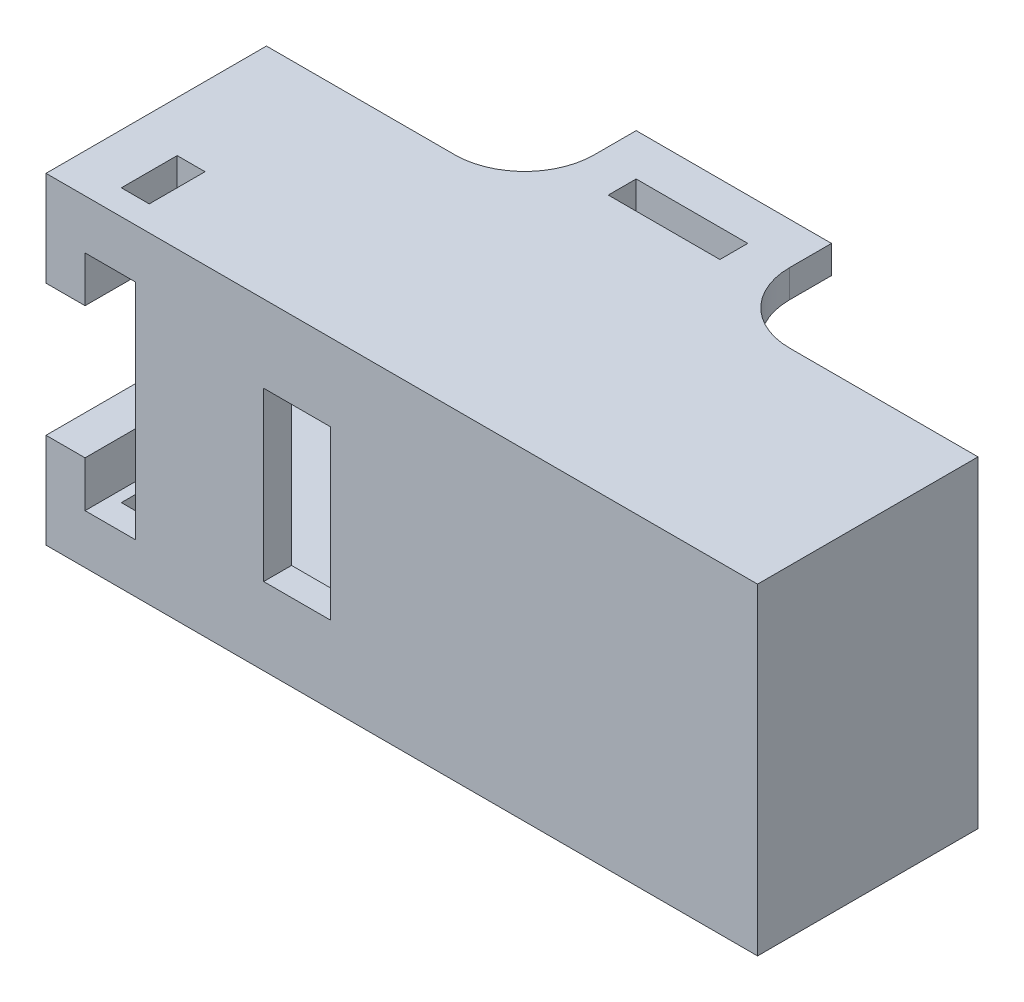
from build123d import *

# Parameters (mm, degrees)
ESQUISSE1_W                  = 12.75
ESQUISSE1_H                  = 5.77
BASE_EXTRUSION_DEPTH         = 5.95
ENL_V_MAT_EXTRU_1_DEPTH      = 1.68
COQUE1_OUTLINE_W             = 10.15
COQUE1_OUTLINE_H             = 4.77
COQUE1_DEPTH                 = 5.45
COQUE1_2_OUTLINE_W           = 1.6
COQUE1_2_OUTLINE_H           = 4.77
COQUE1_2_DEPTH               = 3.77
ENL_V_MAT_EXTRU_2_DEPTH      = 10.185115677
ENL_V_MAT_EXTRU_3_DEPTH      = 10.185115677
ENL_V_MAT_EXTRU_3_DEPTH_BACK = 10.185115677
ESQUISSE4_W                  = 2
ESQUISSE4_H                  = 0.5
ESQUISSE4_W_2                = 0.5
ESQUISSE4_H_2                = 1
ESQUISSE5_W                  = 1.2
ESQUISSE5_H                  = 3
ENL_V_MAT_EXTRU_4_DEPTH      = 10.185115677


# Read off the part's stored shape, not the designer's step: Coque1
with BuildPart() as part:
    # Esquisse1 → Base-Extrusion (new body)
    with BuildSketch(Plane.XY):
        Rectangle(ESQUISSE1_W, ESQUISSE1_H)
    extrude(amount=BASE_EXTRUSION_DEPTH)

    # Esquisse2 → Enlèv. mat.-Extru.1 (cut)
    with BuildSketch(Plane.XY.offset(5.95)):
        Polygon((-5.675, 2), (-4.775, 2), (-4.775, -2), (-5.675, -2), (-5.675, -1.18), (-6.375, -1.18), (-6.375, 1.18), (-5.675, 1.18), align=None)
    extrude(amount=-ENL_V_MAT_EXTRU_1_DEPTH, mode=Mode.SUBTRACT)

    # Coque1 outline → Coque1 (cut)
    with BuildSketch(Plane.XY):
        with Locations((0.8, 0)):
            Rectangle(COQUE1_OUTLINE_W, COQUE1_OUTLINE_H)
    extrude(amount=COQUE1_DEPTH, mode=Mode.SUBTRACT)

    # Coque1 2 outline → Coque1 2 (cut)
    with BuildSketch(Plane.XY):
        with Locations((-5.075, 0)):
            Rectangle(COQUE1_2_OUTLINE_W, COQUE1_2_OUTLINE_H)
    extrude(amount=COQUE1_2_DEPTH, mode=Mode.SUBTRACT)

    # Esquisse3 → Enlèv. mat.-Extru.2 (cut, symmetric)
    with BuildSketch(Plane(origin=(0, 0, 0), x_dir=(1, 0, 0), z_dir=(0, 1, 0))):
        with BuildLine():
            Line((6.375, -2), (3, -2))
            ThreePointArc((3, -2), (2.116116524, -1.633883476), (1.75, -0.75))
            Line((1.75, -0.75), (1.75, 0))
            Line((1.75, 0), (6.375, 0))
            Line((6.375, 0), (6.375, -2))
        make_face()
    enl_v_mat_extru_2 = extrude(amount=ENL_V_MAT_EXTRU_2_DEPTH, both=True, mode=Mode.SUBTRACT)

    # Symétrie1: Enlèv. mat.-Extru.2 across plane
    add(enl_v_mat_extru_2.mirror(Plane(origin=(0, 0, 0), x_dir=(0, 0, 1), z_dir=(1, 0, 0))), mode=Mode.SUBTRACT)

    # Esquisse4 → Enlèv. mat.-Extru.3 (cut, two sides: drawn at the far end of the back side and taken through both)
    with BuildSketch(Plane(origin=(0, 0, 0), x_dir=(1, 0, 0), z_dir=(0, 1, 0)).offset(-ENL_V_MAT_EXTRU_3_DEPTH_BACK)):
        with Locations((0, -1)):
            Rectangle(ESQUISSE4_W, ESQUISSE4_H)
        with Locations((-5.225, -5)):
            Rectangle(ESQUISSE4_W_2, ESQUISSE4_H_2)
    extrude(amount=ENL_V_MAT_EXTRU_3_DEPTH + ENL_V_MAT_EXTRU_3_DEPTH_BACK, mode=Mode.SUBTRACT)

    # Esquisse5 → Enlèv. mat.-Extru.4 (cut, through all)
    with BuildSketch(Plane.XY.offset(5.95)):
        with Locations((-1.875, 0)):
            Rectangle(ESQUISSE5_W, ESQUISSE5_H)
    extrude(amount=-ENL_V_MAT_EXTRU_4_DEPTH, mode=Mode.SUBTRACT)


solid = part.part
